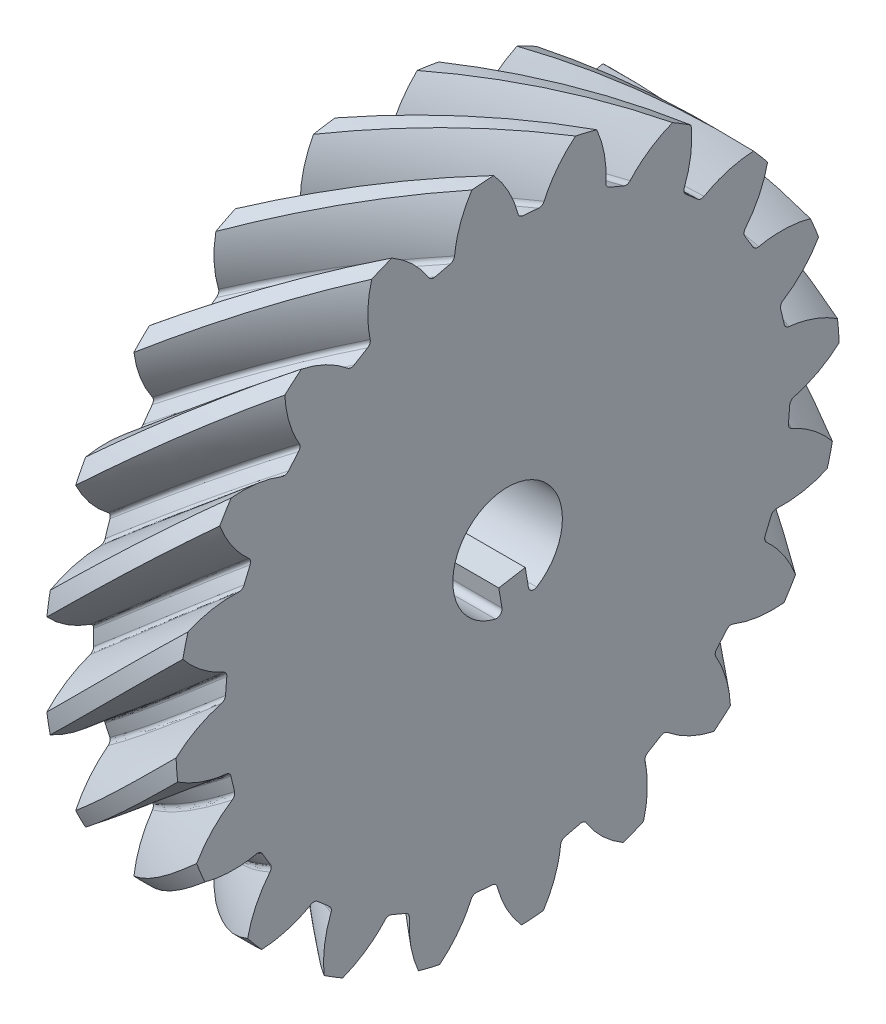
from build123d import *

# Parameters (mm, degrees)
BASPROSKE_W            = 12
BASPROSKE_H            = 30.284271247
TOOTHCUTLH_PITCH       = 190.281688141
TOOTHCUTLH_HEIGHT      = 12
TOOTHCUTLH_RADIUS      = 30.284271247
TOOTHCUTLH_START_ANGLE = -90
TEETHCUTSLH_COUNT      = 20
TEETHCUTSLH_ANGLE      = 342
BORSKE_R               = 5
BORE_DEPTH             = 62.5000025
BOSS_EXTRUDE1_DEPTH    = 12
FILLET1_R              = 0.5


with BuildPart() as part:
    # BasProSke → Base-Revolve (revolve)
    with BuildSketch(Plane(origin=(0, 0, 0), x_dir=(1, 0, 0), z_dir=(0, 1, 0)), mode=Mode.PRIVATE) as base_revolve_sk:
        with Locations((6, 15.142135624)):
            Rectangle(BASPROSKE_W, BASPROSKE_H)
    revolve(base_revolve_sk.sketch.rotate(Axis((-10, 0, 0), (1, 0, 0)), 180), axis=Axis((-10, 0, 0), (1, 0, 0)))

    # ToothCutLH: sweep along a helix
    with BuildLine() as toothcutlh_path:
        add(Helix(TOOTHCUTLH_PITCH, TOOTHCUTLH_HEIGHT, TOOTHCUTLH_RADIUS, center=(0, 0, 0), direction=(1, 0, 0), lefthand=True, mode=Mode.PRIVATE).rotate(Axis((0, 0, 0), (1, 0, 0)), TOOTHCUTLH_START_ANGLE))
    # TooCutSkeRH<3> → ToothCutLH (sweep, cut)
    with BuildSketch(Plane(origin=(0, 0, 0), x_dir=(0, 0, -1), z_dir=(1, 0, 0))):
        with BuildLine():
            ThreePointArc((0.709729235, 25.774501512), (0, 25.784271247), (-0.709729235, 25.774501512))
            ThreePointArc((-0.709729235, 25.774501512), (-1.007455511, 25.862538868), (-1.196142332, 26.109092706))
            ThreePointArc((-1.196142332, 26.109092706), (-2.588726145, 28.736284217), (-4.692249269, 30.837858717))
            ThreePointArc((-4.692249269, 30.837858717), (0, 31.192799385), (4.692249269, 30.837858717))
            ThreePointArc((4.692249269, 30.837858717), (2.588726145, 28.736284217), (1.196142332, 26.109092706))
            ThreePointArc((1.196142332, 26.109092706), (1.007455511, 25.862538868), (0.709729235, 25.774501512))
        make_face()
    toothcutlh = sweep(path=toothcutlh_path.line, is_frenet=True, mode=Mode.SUBTRACT)

    # TeethCutsLH: ToothCutLH ×20 about axis
    teethcutslh_axis = Axis((-10, 0, 0), (1, 0, 0))
    for i in range(1, TEETHCUTSLH_COUNT):
        add(toothcutlh.rotate(teethcutslh_axis, i * TEETHCUTSLH_ANGLE / (TEETHCUTSLH_COUNT - 1)), mode=Mode.SUBTRACT)

    # BorSke → Bore (cut, symmetric)
    with BuildSketch(Plane(origin=(0, 0, 0), x_dir=(0, 0, -1), z_dir=(1, 0, 0))):
        with Locations(Location((0, 0, 0), (0, 0, 180))):
            Circle(BORSKE_R)
    extrude(amount=BORE_DEPTH, both=True, mode=Mode.SUBTRACT)

    # Sketch3 → Boss-Extrude1 (add)
    with BuildSketch(Plane(origin=(12, 0, 0), x_dir=(0, 0, -1), z_dir=(1, 0, 0))):
        Polygon((1.608057754, -2.162021551), (-0.807643232, -2.570587064), (-0.227733646, -5.99938395), (2.18796734, -5.590818437), align=None)
    extrude(amount=-BOSS_EXTRUDE1_DEPTH)

    # Fillet1
    fillet1_edges = [part.edges().sort_by_distance(p)[0] for p in [
        (6, -4.984017488, 0.399461738),
        (6, -4.575453858, -2.016239567),
    ]]
    fillet(fillet1_edges, radius=FILLET1_R)


solid = part.part
